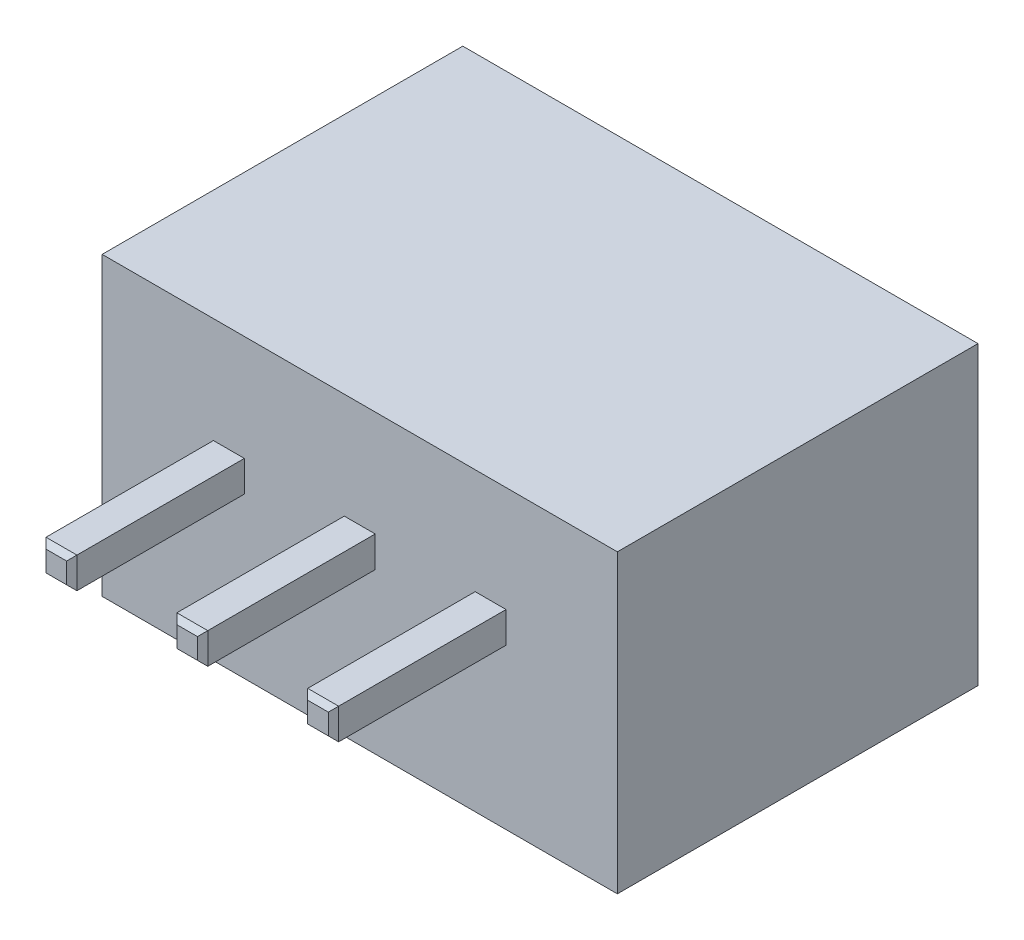
from build123d import *

# Parameters (mm, degrees)
ESBO_O1_W                       = 10
ESBO_O1_H                       = 5.75
RESSALTO_EXTRUS_O1_DEPTH        = 7
ESBO_O2_W                       = 0.6
ESBO_O2_H                       = 0.6
RESSALTO_EXTRUS_O2_DEPTH        = 3.35
CHANFRO1_SIZE                   = 0.1
PADR_O_LINEAR1_COUNT            = 2
PADR_O_LINEAR1_PITCH            = 2.54
CHANFRO1_OF_PADR_O_LINEAR1_SIZE = 0.1
PADR_O_START                    = 0.325
PADR_O_LINEAR2_DEPTH            = 0.4
PADR_O_START_2                  = -2.84
PADR_O_LINEAR2_2_DEPTH          = 0.6
PADR_O_START_3                  = -9.256027766
PADR_O_LINEAR2_3_OUTLINE_W      = 1.336074683
PADR_O_LINEAR2_3_OUTLINE_H      = 1.275
PADR_O_LINEAR2_3_OUTLINE_H_2    = 1.325
PADR_O_LINEAR2_3_DEPTH          = 1.256027766
PADR_O_START_4                  = -10
PADR_O_LINEAR2_4_OUTLINE_W      = 1.663925317
PADR_O_LINEAR2_4_OUTLINE_H      = 1.275
PADR_O_LINEAR2_4_OUTLINE_H_2    = 1.325
PADR_O_LINEAR2_4_DEPTH          = 0.743972234


with BuildPart() as part:
    # Esboço1 → Ressalto-extrusão1 (new body)
    with BuildSketch(Plane.XY):
        Rectangle(ESBO_O1_W, ESBO_O1_H)
    extrude(amount=RESSALTO_EXTRUS_O1_DEPTH)

    # Esboço2 → Ressalto-extrusão2 (add)
    with BuildSketch(Plane.XY.offset(7)):
        with Locations((0, 0.525)):
            Rectangle(ESBO_O2_W, ESBO_O2_H)
    ressalto_extrus_o2 = extrude(amount=RESSALTO_EXTRUS_O2_DEPTH)

    # Chanfro1
    chanfro1_edges = [part.edges().sort_by_distance(p)[0] for p in [
        (0.3, 0.525, 10.35),
        (0, 0.825, 10.35),
        (-0.3, 0.525, 10.35),
        (0, 0.225, 10.35),
    ]]
    chamfer(chanfro1_edges, length=CHANFRO1_SIZE)

    # Padrão linear1: Ressalto-extrusão2 ×2
    with Locations(*[(i * PADR_O_LINEAR1_PITCH, 0, 0) for i in range(1, PADR_O_LINEAR1_COUNT)]):
        add(ressalto_extrus_o2)

    # Chanfro1 of Padrão linear1
    chanfro1_of_padr_o_linear1_edges = [part.edges().sort_by_distance(p)[0] for p in [
        (2.84, 0.525, 10.35),
        (2.54, 0.825, 10.35),
        (2.24, 0.525, 10.35),
        (2.54, 0.225, 10.35),
    ]]
    chamfer(chanfro1_of_padr_o_linear1_edges, length=CHANFRO1_OF_PADR_O_LINEAR1_SIZE)

    # Padrão linear2: read off the stored shape, not the designer's step
    # Padrão linear2 outline → Padrão linear2 (add)
    with BuildSketch(Plane(origin=(0, 0, 0), x_dir=(1, 0, 0), z_dir=(0, 1, 0)).offset(PADR_O_START)):
        Polygon((-2.84, -10.25), (-2.74, -10.35), (-2.34, -10.35), (-2.24, -10.25), (-2.24, -7), (-2.84, -7), align=None)
    extrude(amount=PADR_O_LINEAR2_DEPTH)

    # Padr_o linear2 2 outline → Padr_o linear2 2 (add)
    with BuildSketch(Plane.YZ.offset(PADR_O_START_2)):
        Polygon((0.225, 7), (0.325, 7), (0.325, 10.35), (0.225, 10.25), align=None)
        Polygon((0.825, 7), (0.825, 10.25), (0.725, 10.35), (0.725, 7), align=None)
    extrude(amount=PADR_O_LINEAR2_2_DEPTH)

    # Padr_o linear2 3 outline → Padr_o linear2 3 (cut)
    with BuildSketch(Plane(origin=(0, 0, 0), x_dir=(0.7071067811865471, 0, 0.707106781186548), z_dir=(0.707106781186548, 0, -0.707106781186547)).offset(PADR_O_START_3)):
        with Locations((6.331962659, -1.3625)):
            Rectangle(PADR_O_LINEAR2_3_OUTLINE_W, PADR_O_LINEAR2_3_OUTLINE_H)
        with Locations((6.331962659, 0.3375)):
            Rectangle(PADR_O_LINEAR2_3_OUTLINE_W, PADR_O_LINEAR2_3_OUTLINE_H_2)
    extrude(amount=PADR_O_LINEAR2_3_DEPTH, mode=Mode.SUBTRACT)

    # Padr_o linear2 4 outline → Padr_o linear2 4 (cut)
    with BuildSketch(Plane(origin=(0, 0, 0), x_dir=(0.7071067811865471, 0, 0.707106781186548), z_dir=(0.707106781186548, 0, -0.707106781186547)).offset(PADR_O_START_4)):
        with Locations((4.831962659, -1.3625)):
            Rectangle(PADR_O_LINEAR2_4_OUTLINE_W, PADR_O_LINEAR2_4_OUTLINE_H)
        with Locations((4.831962659, 0.3375)):
            Rectangle(PADR_O_LINEAR2_4_OUTLINE_W, PADR_O_LINEAR2_4_OUTLINE_H_2)
    extrude(amount=PADR_O_LINEAR2_4_DEPTH, mode=Mode.SUBTRACT)


solid = part.part
